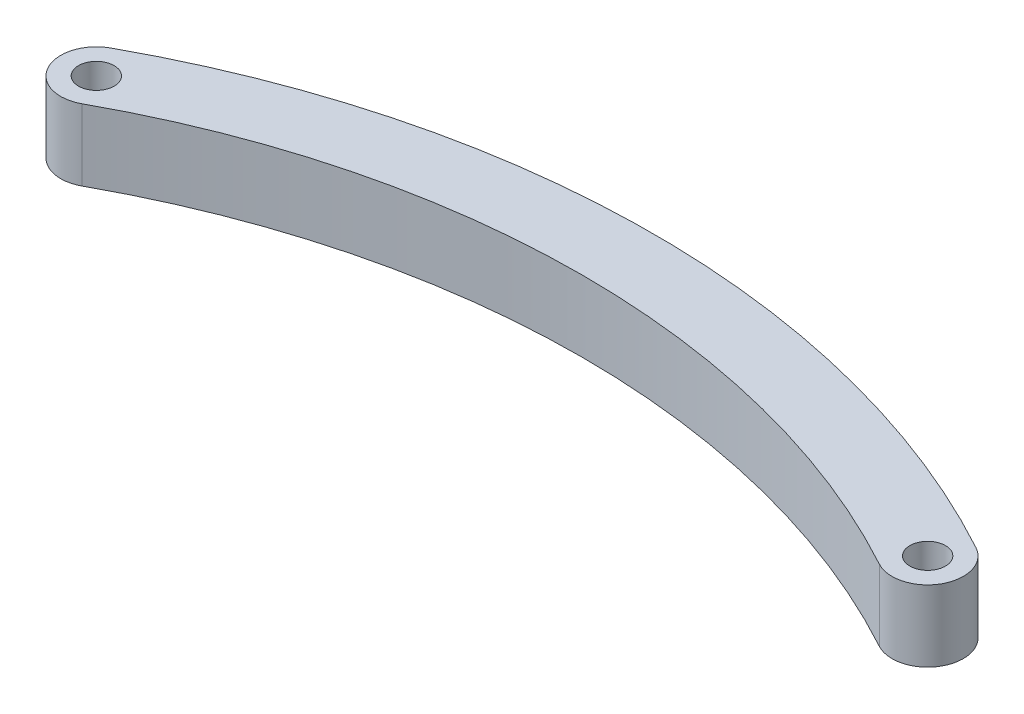
from build123d import *

# Parameters (mm, degrees)
ESQUISSE1_R        = 1.5
BOSS_EXTRU_1_DEPTH = 6


with BuildPart() as part:
    # Esquisse1 → Boss.-Extru.1 (new body)
    with BuildSketch(Plane(origin=(0, 0, 0), x_dir=(1, 0, 0), z_dir=(0, 1, 0))):
        with BuildLine():
            ThreePointArc((-36.438356038, 2.632704296), (-37.632704242, -1.438356135), (-33.561643767, -2.632704189))
            ThreePointArc((-33.561643767, -2.632704189), (6.8e-08, 5.937530488), (33.561643886, -2.632704254))
            ThreePointArc((33.561643886, -2.632704254), (37.632704286, -1.438356055), (36.438355996, 2.632704318))
            ThreePointArc((36.438355996, 2.632704318), (-2.4e-08, 11.937530488), (-36.438356038, 2.632704296))
        make_face()
        with Locations((-35, 0)):
            Circle(ESQUISSE1_R, mode=Mode.SUBTRACT)
        with Locations((35, 0)):
            Circle(ESQUISSE1_R, mode=Mode.SUBTRACT)
    extrude(amount=BOSS_EXTRU_1_DEPTH)


solid = part.part
